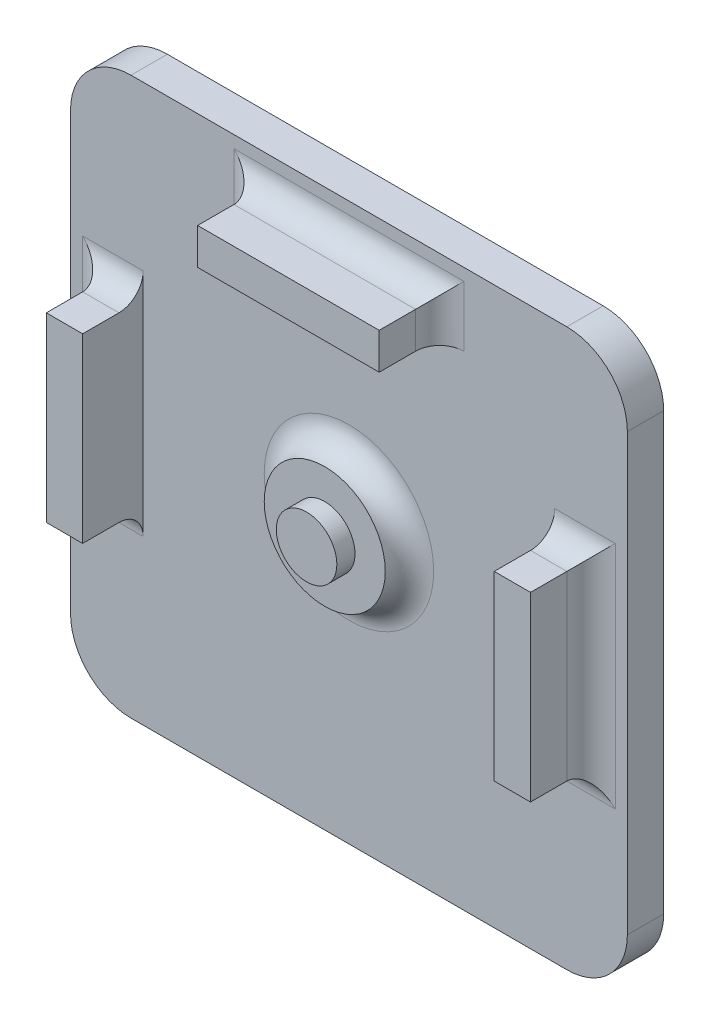
from build123d import *

# Parameters (mm, degrees)
SKETCH_1_W      = 46
SKETCH_1_H      = 46
EXTRUDE_1_DEPTH = 3
SKETCH_3_R      = 5
EXTRUDE_2_DEPTH = 2
SKETCH_4_R      = 2.5
EXTRUDE_3_DEPTH = 1.5
FILLET_1_R      = 5
FILLET_2_R      = 2
SKETCH_5_W      = 3
SKETCH_5_H      = 15
SKETCH_5_W_2    = 15
SKETCH_5_H_2    = 3
EXTRUDE_4_DEPTH = 5
FILLET_3_R      = 2


with BuildPart() as part:
    # ｽｹｯﾁ1 → ﾎﾞｽ - 押し出し1 (new body)
    with BuildSketch(Plane.XY):
        with Locations((23, 23)):
            Rectangle(SKETCH_1_W, SKETCH_1_H)
    extrude(amount=EXTRUDE_1_DEPTH)

    # ｽｹｯﾁ3 → ﾎﾞｽ - 押し出し2 (add)
    with BuildSketch(Plane.XY.offset(3)):
        with Locations((23, 23)):
            Circle(SKETCH_3_R)
    extrude(amount=EXTRUDE_2_DEPTH)

    # ｽｹｯﾁ4 → ﾎﾞｽ - 押し出し3 (add)
    with BuildSketch(Plane.XY.offset(5)):
        with Locations((23, 23)):
            Circle(SKETCH_4_R)
    extrude(amount=EXTRUDE_3_DEPTH)

    # ﾌｨﾚｯﾄ1
    fillet_1_edges = [part.edges().sort_by_distance(p)[0] for p in [
        (0, 46, 1.5),
        (46, 46, 1.5),
        (46, 0, 1.5),
        (0, 0, 1.5),
    ]]
    fillet(fillet_1_edges, radius=FILLET_1_R)

    # ﾌｨﾚｯﾄ2
    fillet_2_edges = [part.edges().sort_by_distance(p)[0] for p in [
        (18, 23, 3),
    ]]
    fillet(fillet_2_edges, radius=FILLET_2_R - 0.0001)  # a hair under: the kernel refuses the full size

    # ｽｹｯﾁ5 → ﾎﾞｽ - 押し出し4 (add)
    with BuildSketch(Plane.XY.offset(3)):
        with Locations((4.5, 23)):
            Rectangle(SKETCH_5_W, SKETCH_5_H)
        with Locations((23, 41.5)):
            Rectangle(SKETCH_5_W_2, SKETCH_5_H_2)
        with Locations((41.5, 23)):
            Rectangle(SKETCH_5_W, SKETCH_5_H)
    extrude(amount=EXTRUDE_4_DEPTH)

    # ﾌｨﾚｯﾄ3
    fillet_3_edges = [part.edges().sort_by_distance(p)[0] for p in [
        (4.5, 30.5, 3),
        (3, 23, 3),
        (4.5, 15.5, 3),
        (15.5, 41.5, 3),
        (30.5, 41.5, 3),
        (23, 43, 3),
        (41.5, 15.5, 3),
        (43, 23, 3),
        (41.5, 30.5, 3),
    ]]
    fillet(fillet_3_edges, radius=FILLET_3_R)


solid = part.part
